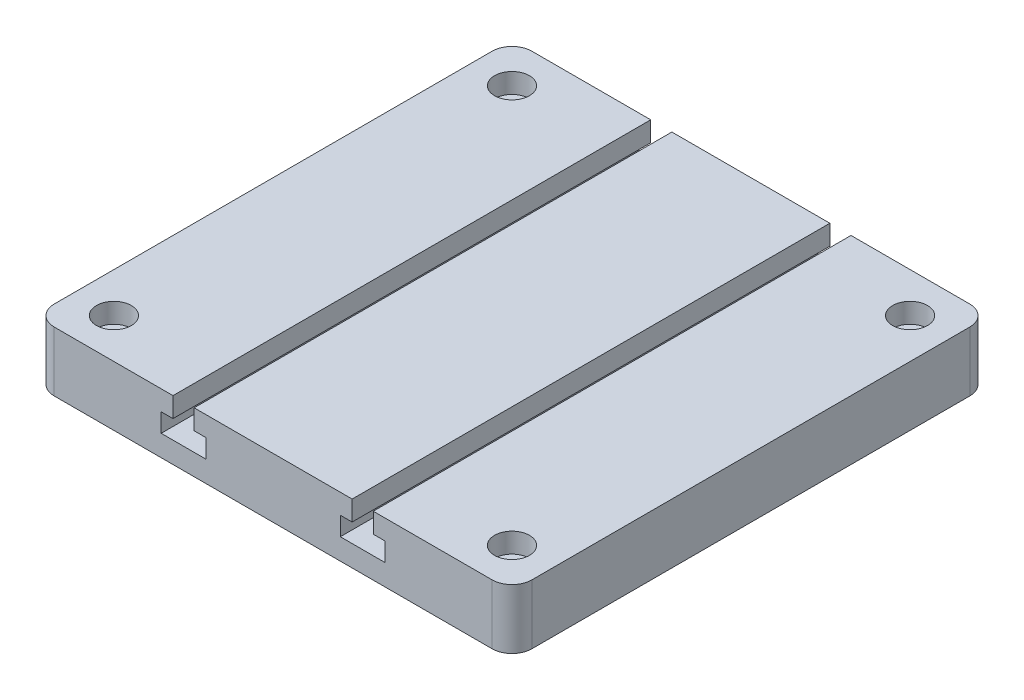
from build123d import *

# Parameters (mm, degrees)
SKETCH1_W                                        = 152.4
SKETCH1_H                                        = 152.4
BOSS_EXTRUDE1_DEPTH                              = 19.05
CBORE_FOR_1_4_SOCKET_HEAD_CAP_SCREW1_D           = 6.5278
CBORE_FOR_1_4_SOCKET_HEAD_CAP_SCREW1_CBORE_D     = 11.1125
CBORE_FOR_1_4_SOCKET_HEAD_CAP_SCREW1_CBORE_DEPTH = 6.35
T_SLOT_CUT_WITH_MCMASTER_8789A16_BIT_DEPTH       = 172.45
FILLET1_R                                        = 6.35


with BuildPart() as part:
    # Sketch1 → Boss-Extrude1 (new body)
    with BuildSketch(Plane(origin=(0, 0, 0), x_dir=(1, 0, 0), z_dir=(0, 1, 0))):
        Rectangle(SKETCH1_W, SKETCH1_H)
    extrude(amount=BOSS_EXTRUDE1_DEPTH)

    # CBORE for 1/4 Socket Head Cap Screw1 (through all)
    with Locations(Plane(origin=(0, 19.05, 0), x_dir=(1, 0, 0), z_dir=(0, 1, 0))):
        with Locations((-63.5, 63.5), (63.5, 63.5), (63.5, -63.5), (-63.5, -63.5)):
            CounterBoreHole(CBORE_FOR_1_4_SOCKET_HEAD_CAP_SCREW1_D / 2, CBORE_FOR_1_4_SOCKET_HEAD_CAP_SCREW1_CBORE_D / 2, CBORE_FOR_1_4_SOCKET_HEAD_CAP_SCREW1_CBORE_DEPTH)

    # Sketch4 → T-SLOT CUT WITH MCMASTER 8789A16 BIT (cut, through all)
    with BuildSketch(Plane.XY.offset(76.2)):
        Polygon((-31.9484375, 19.05), (-31.9484375, 12.7), (-35.71875, 12.7), (-35.71875, 6.746875), (-21.43125, 6.746875), (-21.43125, 12.7), (-25.2015625, 12.7), (-25.2015625, 19.05), align=None)
        Polygon((25.2015625, 12.7), (25.2015625, 19.05), (31.9484375, 19.05), (31.9484375, 12.7), (35.71875, 12.7), (35.71875, 6.746875), (21.43125, 6.746875), (21.43125, 12.7), align=None)
    extrude(amount=-T_SLOT_CUT_WITH_MCMASTER_8789A16_BIT_DEPTH, mode=Mode.SUBTRACT)

    # Fillet1
    fillet1_edges = [part.edges().sort_by_distance(p)[0] for p in [
        (-76.2, 9.525, 76.2),
        (76.2, 9.525, 76.2),
        (76.2, 9.525, -76.2),
        (-76.2, 9.525, -76.2),
    ]]
    fillet(fillet1_edges, radius=FILLET1_R)


solid = part.part
